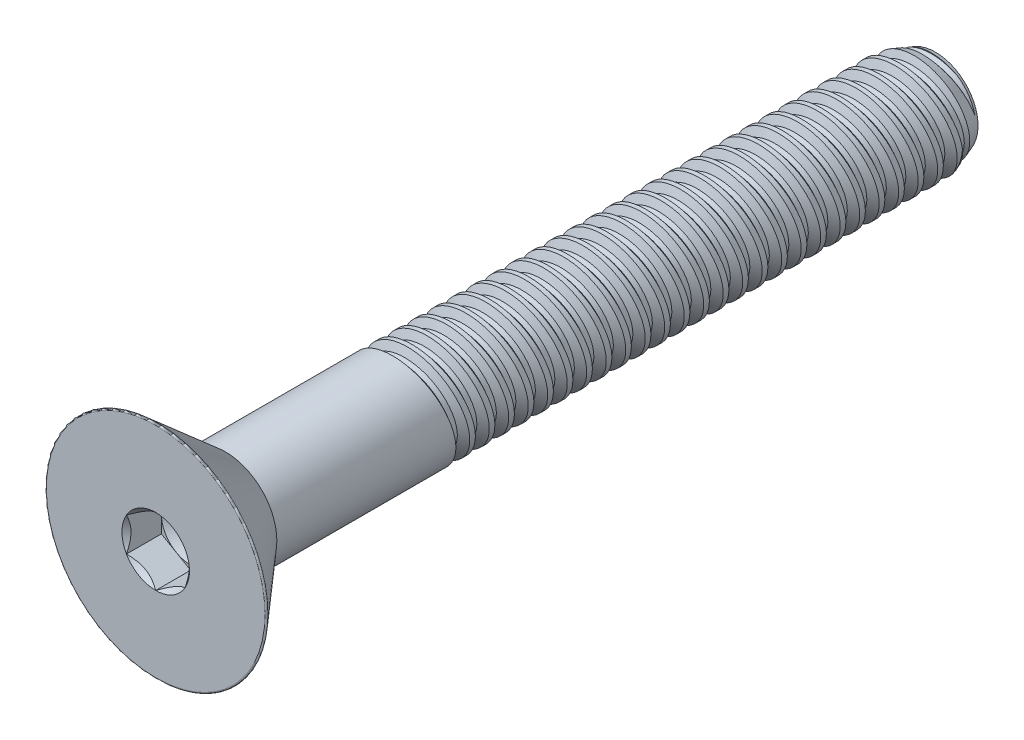
from build123d import *

# Parameters (mm, degrees)
SKETCH1_W          = 28.9052
SKETCH1_H          = 2.0828
LPATTERN1_COUNT    = 28
LPATTERN1_PITCH    = 0.79375
SKETCH4_R          = 4.5593
EXTRUDE1_DEPTH     = 2.8448
FILLET1_R          = 0.0508
CUT_EXTRUDE1_DEPTH = 1.4224
SKETCH8_R          = 1.190625
CUT_EXTRUDE5_DEPTH = 0.474133333
CUT_EXTRUDE5_DRAFT = -60


with BuildPart() as part:
    # Sketch1 → Revolve1 (revolve)
    with BuildSketch(Plane(origin=(0, 0, 0), x_dir=(0, 0, -1), z_dir=(1, 0, 0)), mode=Mode.PRIVATE) as revolve1_sk:
        with Locations((14.4526, 1.0414)):
            Rectangle(SKETCH1_W, SKETCH1_H)
    revolve(revolve1_sk.sketch.rotate(Axis((0, 0, 0), (0, 0, 1)), 143.466023127), axis=Axis((0, 0, 0), (0, 0, 1)))

    # Sketch2 → Cut-Revolve1 (revolve, cut)
    with BuildSketch(Plane(origin=(0, 0, 0), x_dir=(0, 0, -1), z_dir=(1, 0, 0)), mode=Mode.PRIVATE) as cut_revolve1_sk:
        Polygon((6.777665104, 2.101371857), (7.459920832, 2.231374854), (7.29667657, 1.762908932), (7.101746362, 1.725765218), align=None)
    cut_revolve1 = revolve(cut_revolve1_sk.sketch.rotate(Axis((0, -0.162231854, -6.6802), (0, 0.18718091792156163, -0.9823254572523517)), 180), axis=Axis((0, -0.162231854, -6.6802), (0, 0.18718091792156163, -0.9823254572523517)), mode=Mode.SUBTRACT)

    # Sketch3 → Cut-Revolve2 (revolve, cut)
    with BuildSketch(Plane(origin=(0, 0, 0), x_dir=(0, 0, -1), z_dir=(1, 0, 0)), mode=Mode.PRIVATE) as cut_revolve2_sk:
        Polygon((28.9052, 1.725765218), (27.924255, 2.0828), (28.9052, 2.0828), align=None)
    revolve(cut_revolve2_sk.sketch.rotate(Axis((0, 0, -27.924255), (0, 0, 1)), 143.466023127), axis=Axis((0, 0, -27.924255), (0, 0, 1)), mode=Mode.SUBTRACT)

    # LPattern1: Cut-Revolve1 ×28
    with Locations(*[(0, 0, -i * LPATTERN1_PITCH) for i in range(1, LPATTERN1_COUNT)]):
        add(cut_revolve1, mode=Mode.SUBTRACT)

    # Sketch4 → Extrude1 (add)
    with BuildSketch(Plane.XY):
        Circle(SKETCH4_R)
    extrude(amount=EXTRUDE1_DEPTH)

    # Sketch9 → Cut-Revolve3 (revolve, cut)
    with BuildSketch(Plane(origin=(0, 0, 0), x_dir=(0, 0, -1), z_dir=(1, 0, 0)), mode=Mode.PRIVATE) as cut_revolve3_sk:
        Polygon((-2.8448, 4.5593), (0, 2.086353088), (0, 4.5593), align=None)
    revolve(cut_revolve3_sk.sketch.rotate(Axis((0, 0, 0), (0, 0, 1)), 270), axis=Axis((0, 0, 0), (0, 0, 1)), mode=Mode.SUBTRACT)

    # Fillet1
    fillet1_edges = [part.edges().sort_by_distance(p)[0] for p in [
        (-4.5593, 0, 2.8448),
    ]]
    fillet(fillet1_edges, radius=FILLET1_R)

    # Sketch6 → Cut-Extrude1 (cut)
    with BuildSketch(Plane.XY.offset(2.8448)):
        Polygon((0, -1.374815329), (1.190625, -0.687407664), (1.190625, 0.687407664), (0, 1.374815329), (-1.190625, 0.687407664), (-1.190625, -0.687407664), align=None)
    extrude(amount=-CUT_EXTRUDE1_DEPTH, mode=Mode.SUBTRACT)

    # Cut-Extrude4 cone 1 section (through the dimple's axis) → Cut-Extrude4 (revolve, cut)
    with BuildSketch(Plane(origin=(0, 0, 2.8448), x_dir=(0, -1, 0), z_dir=(1, 0, 0))):
        Polygon((0, 0), (1.374815329, 0), (0, 1.374815329), align=None)
    revolve(axis=Axis((0, 0, 2.8448), (0, 0, -1)), mode=Mode.SUBTRACT)


with BuildPart() as cut_extrude5_tool:
    # Sketch8 → Cut-Extrude5 (with draft: the straight prism first)
    with BuildSketch(Plane.XY.offset(1.4224)):
        Circle(SKETCH8_R)
    extrude(amount=-CUT_EXTRUDE5_DEPTH)
    # Cut-Extrude5: the draft: its side faces are tilted about the plane it starts from
    cut_extrude5_sides = [cut_extrude5_tool.faces().sort_by_distance(p)[0] for p in [
        (-1.190625, 0, 1.185333333),
    ]]
    draft(cut_extrude5_sides, Plane.XY.offset(1.4224), CUT_EXTRUDE5_DRAFT)


with BuildPart() as part_1:
    add(part.part)

    # Cut-Extrude5: cut by cut_extrude5_tool
    add(cut_extrude5_tool.part, mode=Mode.SUBTRACT)


solid = part_1.part
